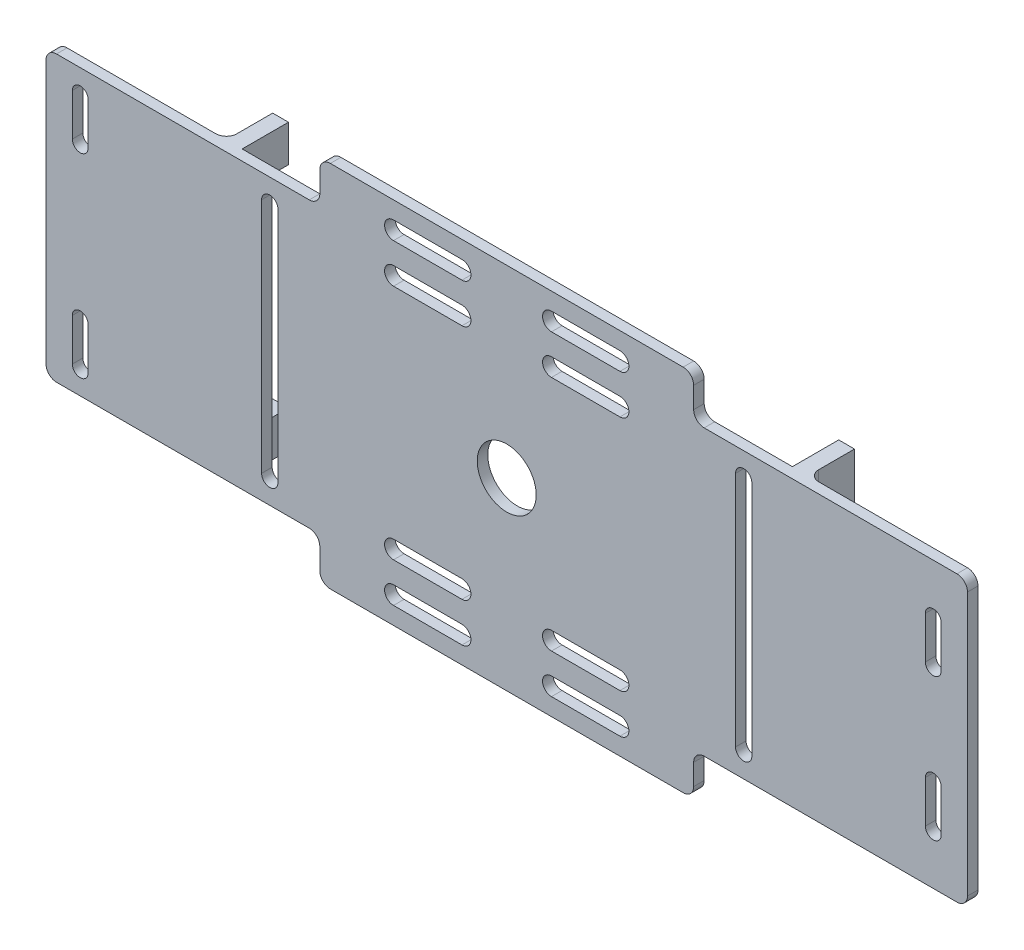
from build123d import *

# Parameters (mm, degrees)
EXTRUDE_1_DEPTH     = 2
SKETCH_2_R          = 5.6
CUT_EXTRUDE_1_DEPTH = 95.26160406
SKETCH_5_W          = 3
SKETCH_5_H          = 54
EXTRUDE_2_DEPTH     = 10.8
FILLET_1_R          = 2
SKETCH_6_W          = 3
SKETCH_6_H          = 40
CUT_EXTRUDE_3_DEPTH = 6
FILLET_2_R          = 2
FILLET_3_R          = 2


with BuildPart() as part:
    # 草圖1 → 填料-伸長1 (new body)
    with BuildSketch(Plane.XY):
        with BuildLine():
            Line((35.5, 33), (35.5, 29))
            ThreePointArc((35.5, 29), (36.085786438, 27.585786438), (37.5, 27))
            Line((37.5, 27), (85.5, 27))
            ThreePointArc((85.5, 27), (86.914213562, 26.414213562), (87.5, 25))
            Line((87.5, 25), (87.5, -25))
            ThreePointArc((87.5, -25), (86.914213562, -26.414213562), (85.5, -27))
            Line((85.5, -27), (37.5, -27))
            ThreePointArc((37.5, -27), (36.085786438, -27.585786438), (35.5, -29))
            Line((35.5, -29), (35.5, -33))
            ThreePointArc((35.5, -33), (34.914213562, -34.414213562), (33.5, -35))
            Line((33.5, -35), (-33.5, -35))
            ThreePointArc((-33.5, -35), (-34.914213562, -34.414213562), (-35.5, -33))
            Line((-35.5, -33), (-35.5, -29))
            ThreePointArc((-35.5, -29), (-36.085786438, -27.585786438), (-37.5, -27))
            Line((-37.5, -27), (-85.5, -27))
            ThreePointArc((-85.5, -27), (-86.914213562, -26.414213562), (-87.5, -25))
            Line((-87.5, -25), (-87.5, 25))
            ThreePointArc((-87.5, 25), (-86.914213562, 26.414213562), (-85.5, 27))
            Line((-85.5, 27), (-37.5, 27))
            ThreePointArc((-37.5, 27), (-36.085786438, 27.585786438), (-35.5, 29))
            Line((-35.5, 29), (-35.5, 33))
            ThreePointArc((-35.5, 33), (-34.914213562, 34.414213562), (-33.5, 35))
            Line((-33.5, 35), (33.5, 35))
            ThreePointArc((33.5, 35), (34.914213562, 34.414213562), (35.5, 33))
        make_face()
    extrude(amount=EXTRUDE_1_DEPTH)

    # 草圖2 → 除料-伸長1 (cut, through all)
    with BuildSketch(Plane.XY.offset(2)):
        Circle(SKETCH_2_R)
        with BuildLine():
            Line((43.45, -22.5), (43.45, 22.5))
            ThreePointArc((43.45, 22.5), (45, 24.05), (46.55, 22.5))
            Line((46.55, 22.5), (46.55, -22.5))
            ThreePointArc((46.55, -22.5), (45, -24.05), (43.45, -22.5))
        make_face()
        with BuildLine():
            Line((-46.55, -22.5), (-46.55, 22.5))
            ThreePointArc((-46.55, 22.5), (-45, 24.05), (-43.45, 22.5))
            Line((-43.45, 22.5), (-43.45, -22.5))
            ThreePointArc((-43.45, -22.5), (-45, -24.05), (-46.55, -22.5))
        make_face()
        with BuildLine():
            Line((21.5, 28.3), (8.5, 28.3))
            ThreePointArc((8.5, 28.3), (6.8, 30), (8.5, 31.7))
            Line((8.5, 31.7), (21.5, 31.7))
            ThreePointArc((21.5, 31.7), (23.2, 30), (21.5, 28.3))
        make_face()
        with BuildLine():
            Line((21.5, 20.8), (8.5, 20.8))
            ThreePointArc((8.5, 20.8), (6.8, 22.5), (8.5, 24.2))
            Line((8.5, 24.2), (21.5, 24.2))
            ThreePointArc((21.5, 24.2), (23.2, 22.5), (21.5, 20.8))
        make_face()
        with BuildLine():
            Line((-21.5, 28.3), (-8.5, 28.3))
            ThreePointArc((-8.5, 28.3), (-6.8, 30), (-8.5, 31.7))
            Line((-8.5, 31.7), (-21.5, 31.7))
            ThreePointArc((-21.5, 31.7), (-23.2, 30), (-21.5, 28.3))
        make_face()
        with BuildLine():
            Line((-21.5, 20.8), (-8.5, 20.8))
            ThreePointArc((-8.5, 20.8), (-6.8, 22.5), (-8.5, 24.2))
            Line((-8.5, 24.2), (-21.5, 24.2))
            ThreePointArc((-21.5, 24.2), (-23.2, 22.5), (-21.5, 20.8))
        make_face()
        with BuildLine():
            Line((21.5, -28.3), (8.5, -28.3))
            ThreePointArc((8.5, -28.3), (6.8, -30), (8.5, -31.7))
            Line((8.5, -31.7), (21.5, -31.7))
            ThreePointArc((21.5, -31.7), (23.2, -30), (21.5, -28.3))
        make_face()
        with BuildLine():
            Line((21.5, -20.8), (8.5, -20.8))
            ThreePointArc((8.5, -20.8), (6.8, -22.5), (8.5, -24.2))
            Line((8.5, -24.2), (21.5, -24.2))
            ThreePointArc((21.5, -24.2), (23.2, -22.5), (21.5, -20.8))
        make_face()
        with BuildLine():
            Line((-21.5, -28.3), (-8.5, -28.3))
            ThreePointArc((-8.5, -28.3), (-6.8, -30), (-8.5, -31.7))
            Line((-8.5, -31.7), (-21.5, -31.7))
            ThreePointArc((-21.5, -31.7), (-23.2, -30), (-21.5, -28.3))
        make_face()
        with BuildLine():
            Line((-21.5, -20.8), (-8.5, -20.8))
            ThreePointArc((-8.5, -20.8), (-6.8, -22.5), (-8.5, -24.2))
            Line((-8.5, -24.2), (-21.5, -24.2))
            ThreePointArc((-21.5, -24.2), (-23.2, -22.5), (-21.5, -20.8))
        make_face()
        with BuildLine():
            Line((79.5, 9.5), (79.5, 17.5))
            ThreePointArc((79.5, 17.5), (81, 19), (82.5, 17.5))
            Line((82.5, 17.5), (82.5, 9.5))
            ThreePointArc((82.5, 9.5), (81, 8), (79.5, 9.5))
        make_face()
        with BuildLine():
            Line((82.5, -17.5), (82.5, -9.5))
            ThreePointArc((82.5, -9.5), (81, -8), (79.5, -9.5))
            Line((79.5, -9.5), (79.5, -17.5))
            ThreePointArc((79.5, -17.5), (81, -19), (82.5, -17.5))
        make_face()
        with BuildLine():
            Line((-82.5, 22.5), (-82.5, 14.5))
            ThreePointArc((-82.5, 14.5), (-81, 13), (-79.5, 14.5))
            Line((-79.5, 14.5), (-79.5, 22.5))
            ThreePointArc((-79.5, 22.5), (-81, 24), (-82.5, 22.5))
        make_face()
        with BuildLine():
            Line((-79.5, -22.5), (-79.5, -14.5))
            ThreePointArc((-79.5, -14.5), (-81, -13), (-82.5, -14.5))
            Line((-82.5, -14.5), (-82.5, -22.5))
            ThreePointArc((-82.5, -22.5), (-81, -24), (-79.5, -22.5))
        make_face()
    extrude(amount=-CUT_EXTRUDE_1_DEPTH, mode=Mode.SUBTRACT)

    # 草圖5 → 填料-伸長2 (add)
    with BuildSketch(Plane.XY.offset(2)):
        with Locations((-53.75, 0)):
            Rectangle(SKETCH_5_W, SKETCH_5_H)
        with Locations((53.75, 0)):
            Rectangle(SKETCH_5_W, SKETCH_5_H)
    extrude(amount=-EXTRUDE_2_DEPTH)

    # 圓角1
    fillet_1_edges = [part.edges().sort_by_distance(p)[0] for p in [
        (55.25, 0, 0),
    ]]
    fillet(fillet_1_edges, radius=FILLET_1_R)

    # 草圖6 → 除料-伸長3 (cut)
    with BuildSketch(Plane(origin=(0, 0, -8.8), x_dir=(-1, 0, 0), z_dir=(0, 0, -1))):
        with Locations((53.75, 0)):
            Rectangle(SKETCH_6_W, SKETCH_6_H)
    extrude(amount=-CUT_EXTRUDE_3_DEPTH, mode=Mode.SUBTRACT)

    # 圓角2
    fillet_2_edges = [part.edges().sort_by_distance(p)[0] for p in [
        (-53.75, -20, -2.8),
        (-53.75, 20, -2.8),
    ]]
    fillet(fillet_2_edges, radius=FILLET_2_R)

    # 圓角3
    fillet_3_edges = [part.edges().sort_by_distance(p)[0] for p in [
        (-55.25, 0, 0),
    ]]
    fillet(fillet_3_edges, radius=FILLET_3_R)


solid = part.part
